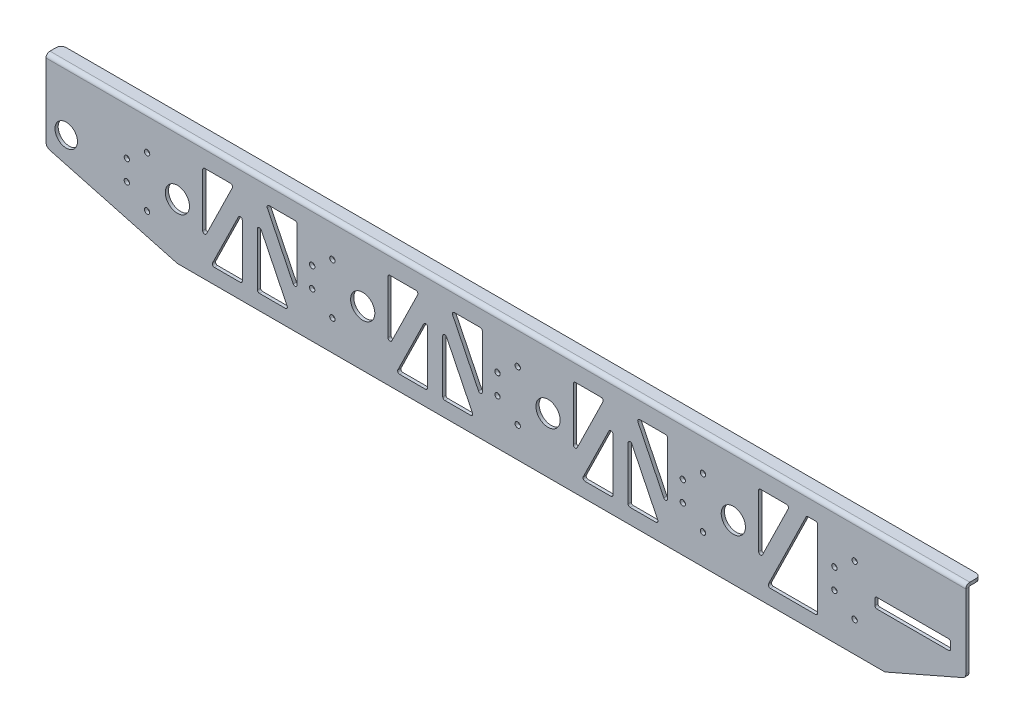
from build123d import *

# Parameters (mm, degrees)
SKETCH1_R                    = 11.9875
SKETCH1_R_2                  = 11.1125
SKETCH1_W                    = 75
SKETCH1_H                    = 10.02
BASE_FLANGE1_DEPTH           = 3.175
EDGE_FLANGE1_STRIP_W         = 14.1732
EDGE_FLANGE1_STRIP_H         = 3.175
EDGE_FLANGE1_STRIP_CUT_DEPTH = 910
EDGE_FLANGE1_DEPTH           = 910
M5_CLEARANCE_HOLE1_D         = 5.3
CUT_EXTRUDE2_REACH           = 784.448
FILLET1_R                    = 2
FILLET2_R                    = 5


# Sheet-metal steps are written as plain solids
with BuildPart() as part:
    # Sketch1 → Base-Flange1 (new body)
    with BuildSketch(Plane.XY):
        Polygon((-130, 60), (780, 60), (780, -20), (700, -55), (0, -55), (-130, -20), align=None)
        Circle(SKETCH1_R, mode=Mode.SUBTRACT)
        with Locations((183.333333333, 0)):
            Circle(SKETCH1_R, mode=Mode.SUBTRACT)
        with Locations((366.666666667, 0)):
            Circle(SKETCH1_R, mode=Mode.SUBTRACT)
        with Locations((550, 0)):
            Circle(SKETCH1_R, mode=Mode.SUBTRACT)
        with Locations((-110, 0)):
            Circle(SKETCH1_R_2, mode=Mode.SUBTRACT)
        with Locations((727.5, 0)):
            Rectangle(SKETCH1_W, SKETCH1_H, mode=Mode.SUBTRACT)
    extrude(amount=-BASE_FLANGE1_DEPTH)

    # Edge-Flange1 strip (across the edge) → Edge-Flange1 strip cut (cut)
    with BuildSketch(Plane(origin=(-130, 60, -3.175), x_dir=(0, -1, 0), z_dir=(1, 0, 0))):
        with Locations((-3.175, -1.5875)):
            Rectangle(EDGE_FLANGE1_STRIP_W, EDGE_FLANGE1_STRIP_H)
    extrude(amount=EDGE_FLANGE1_STRIP_CUT_DEPTH, mode=Mode.SUBTRACT)

    # Edge-Flange1 section (across the edge) → Edge-Flange1 (add)
    with BuildSketch(Plane(origin=(-130, 60, -3.175), x_dir=(0, -1, 0), z_dir=(1, 0, 0))):
        with BuildLine():
            Line((0, 0.7366), (0, 11.825))
            Line((0, 11.825), (3.175, 11.825))
            Line((3.175, 11.825), (3.175, 0.7366))
            ThreePointArc((3.175, 0.7366), (3.390745145, 0.215745145), (3.9116, 0))
            Line((3.9116, 0), (3.9116, -3.175))
            ThreePointArc((3.9116, -3.175), (1.145681115, -2.029318885), (0, 0.7366))
        make_face()
    extrude(amount=EDGE_FLANGE1_DEPTH)

    # M5 Clearance Hole1 (through all)
    with Locations(Plane(origin=(-50, 10, 0), x_dir=(1, 0, 0), z_dir=(0, 0, 1))):
        with Locations((0, 0), (0, -20), (20, -35), (20, 15), (183.333333333, 0), (183.333333333, -20), (203.333333333, -35), (203.333333333, 15), (366.666666667, 0), (366.666666667, -20), (386.666666667, -35), (386.666666667, 15), (550, 0), (550, -20), (570, -35), (570, 15), (700, 0), (700, -20), (720, 15), (720, -35)):
            Hole(M5_CLEARANCE_HOLE1_D / 2)

    # Sketch8 → Cut-Extrude2 (cut, up to next)
    with BuildSketch(Plane.XY, mode=Mode.PRIVATE) as cut_extrude2_sk1:
        Polygon((55.816057945, 40), (25, 40), (25, -22.943437506), align=None)
    cut_extrude2_tool1 = extrude(cut_extrude2_sk1.sketch, amount=-CUT_EXTRUDE2_REACH, mode=Mode.PRIVATE) & part.part
    # Sketch8 → Cut-Extrude2 (cut, up to next)
    with BuildSketch(Plane.XY, mode=Mode.PRIVATE) as cut_extrude2_sk2:
        Polygon((64.166666667, -40), (33.350608721, -40), (64.166666667, 22.943437506), align=None)
    cut_extrude2_tool2 = extrude(cut_extrude2_sk2.sketch, amount=-CUT_EXTRUDE2_REACH, mode=Mode.PRIVATE) & part.part
    # Sketch8 → Cut-Extrude2 (cut, up to next)
    with BuildSketch(Plane.XY, mode=Mode.PRIVATE) as cut_extrude2_sk3:
        Polygon((79.166666667, -40), (79.166666667, 22.943437506), (109.982724612, -40), align=None)
    cut_extrude2_tool3 = extrude(cut_extrude2_sk3.sketch, amount=-CUT_EXTRUDE2_REACH, mode=Mode.PRIVATE) & part.part
    # Sketch8 → Cut-Extrude2 (cut, up to next)
    with BuildSketch(Plane.XY, mode=Mode.PRIVATE) as cut_extrude2_sk4:
        Polygon((118.333333333, 40), (118.333333333, -22.943437506), (87.517275388, 40), align=None)
    cut_extrude2_tool4 = extrude(cut_extrude2_sk4.sketch, amount=-CUT_EXTRUDE2_REACH, mode=Mode.PRIVATE) & part.part
    # Sketch8 → Cut-Extrude2 (cut, up to next)
    with BuildSketch(Plane.XY, mode=Mode.PRIVATE) as cut_extrude2_sk5:
        Polygon((239.149391279, 40), (208.333333333, -22.943437506), (208.333333333, 40), align=None)
    cut_extrude2_tool5 = extrude(cut_extrude2_sk5.sketch, amount=-CUT_EXTRUDE2_REACH, mode=Mode.PRIVATE) & part.part
    # Sketch8 → Cut-Extrude2 (cut, up to next)
    with BuildSketch(Plane.XY, mode=Mode.PRIVATE) as cut_extrude2_sk6:
        Polygon((247.5, 22.943437506), (247.5, -40), (216.683942055, -40), align=None)
    cut_extrude2_tool6 = extrude(cut_extrude2_sk6.sketch, amount=-CUT_EXTRUDE2_REACH, mode=Mode.PRIVATE) & part.part
    # Sketch8 → Cut-Extrude2 (cut, up to next)
    with BuildSketch(Plane.XY, mode=Mode.PRIVATE) as cut_extrude2_sk7:
        Polygon((293.316057945, -40), (262.5, -40), (262.5, 22.943437506), align=None)
    cut_extrude2_tool7 = extrude(cut_extrude2_sk7.sketch, amount=-CUT_EXTRUDE2_REACH, mode=Mode.PRIVATE) & part.part
    # Sketch8 → Cut-Extrude2 (cut, up to next)
    with BuildSketch(Plane.XY, mode=Mode.PRIVATE) as cut_extrude2_sk8:
        Polygon((270.850608721, 40), (301.666666667, 40), (301.666666667, -22.943437506), align=None)
    cut_extrude2_tool8 = extrude(cut_extrude2_sk8.sketch, amount=-CUT_EXTRUDE2_REACH, mode=Mode.PRIVATE) & part.part
    # Sketch8 → Cut-Extrude2 (cut, up to next)
    with BuildSketch(Plane.XY, mode=Mode.PRIVATE) as cut_extrude2_sk9:
        Polygon((422.482724612, 40), (391.666666667, -22.943437506), (391.666666667, 40), align=None)
    cut_extrude2_tool9 = extrude(cut_extrude2_sk9.sketch, amount=-CUT_EXTRUDE2_REACH, mode=Mode.PRIVATE) & part.part
    # Sketch8 → Cut-Extrude2 (cut, up to next)
    with BuildSketch(Plane.XY, mode=Mode.PRIVATE) as cut_extrude2_sk10:
        Polygon((430.833333333, 22.943437506), (430.833333333, -40), (400.017275388, -40), align=None)
    cut_extrude2_tool10 = extrude(cut_extrude2_sk10.sketch, amount=-CUT_EXTRUDE2_REACH, mode=Mode.PRIVATE) & part.part
    # Sketch8 → Cut-Extrude2 (cut, up to next)
    with BuildSketch(Plane.XY, mode=Mode.PRIVATE) as cut_extrude2_sk11:
        Polygon((476.649391279, -40), (445.833333333, -40), (445.833333333, 22.943437506), align=None)
    cut_extrude2_tool11 = extrude(cut_extrude2_sk11.sketch, amount=-CUT_EXTRUDE2_REACH, mode=Mode.PRIVATE) & part.part
    # Sketch8 → Cut-Extrude2 (cut, up to next)
    with BuildSketch(Plane.XY, mode=Mode.PRIVATE) as cut_extrude2_sk12:
        Polygon((454.183942055, 40), (485, 40), (485, -22.943437506), align=None)
    cut_extrude2_tool12 = extrude(cut_extrude2_sk12.sketch, amount=-CUT_EXTRUDE2_REACH, mode=Mode.PRIVATE) & part.part
    # Sketch8 → Cut-Extrude2 (cut, up to next)
    with BuildSketch(Plane.XY, mode=Mode.PRIVATE) as cut_extrude2_sk13:
        Polygon((605.816057945, 40), (575, -22.943437506), (575, 40), align=None)
    cut_extrude2_tool13 = extrude(cut_extrude2_sk13.sketch, amount=-CUT_EXTRUDE2_REACH, mode=Mode.PRIVATE) & part.part
    # Sketch8 → Cut-Extrude2 (cut, up to next)
    with BuildSketch(Plane.XY, mode=Mode.PRIVATE) as cut_extrude2_sk14:
        Polygon((614.166666667, 22.943437506), (614.166666667, -40), (583.350608721, -40), align=None)
    cut_extrude2_tool14 = extrude(cut_extrude2_sk14.sketch, amount=-CUT_EXTRUDE2_REACH, mode=Mode.PRIVATE) & part.part
    # Sketch8 → Cut-Extrude2 (cut, up to next)
    with BuildSketch(Plane.XY, mode=Mode.PRIVATE) as cut_extrude2_sk15:
        Polygon((633.350608721, 40), (622.517275388, 40), (614.166666667, 22.943437506), (614.166666667, -40), (633.350608721, -40), align=None)
    cut_extrude2_tool15 = extrude(cut_extrude2_sk15.sketch, amount=-CUT_EXTRUDE2_REACH, mode=Mode.PRIVATE) & part.part
    add(cut_extrude2_tool1.solids().sort_by_distance((35.272019, 19.018854, 0))[0], mode=Mode.SUBTRACT)
    add(cut_extrude2_tool2.solids().sort_by_distance((53.894647, -19.018854, 0))[0], mode=Mode.SUBTRACT)
    add(cut_extrude2_tool3.solids().sort_by_distance((89.438686, -19.018854, 0))[0], mode=Mode.SUBTRACT)
    add(cut_extrude2_tool4.solids().sort_by_distance((108.061314, 19.018854, 0))[0], mode=Mode.SUBTRACT)
    add(cut_extrude2_tool5.solids().sort_by_distance((218.605353, 19.018854, 0))[0], mode=Mode.SUBTRACT)
    add(cut_extrude2_tool6.solids().sort_by_distance((237.227981, -19.018854, 0))[0], mode=Mode.SUBTRACT)
    add(cut_extrude2_tool7.solids().sort_by_distance((272.772019, -19.018854, 0))[0], mode=Mode.SUBTRACT)
    add(cut_extrude2_tool8.solids().sort_by_distance((291.394647, 19.018854, 0))[0], mode=Mode.SUBTRACT)
    add(cut_extrude2_tool9.solids().sort_by_distance((401.938686, 19.018854, 0))[0], mode=Mode.SUBTRACT)
    add(cut_extrude2_tool10.solids().sort_by_distance((420.561314, -19.018854, 0))[0], mode=Mode.SUBTRACT)
    add(cut_extrude2_tool11.solids().sort_by_distance((456.105353, -19.018854, 0))[0], mode=Mode.SUBTRACT)
    add(cut_extrude2_tool12.solids().sort_by_distance((474.727981, 19.018854, 0))[0], mode=Mode.SUBTRACT)
    add(cut_extrude2_tool13.solids().sort_by_distance((585.272019, 19.018854, 0))[0], mode=Mode.SUBTRACT)
    add(cut_extrude2_tool14.solids().sort_by_distance((603.894647, -19.018854, 0))[0], mode=Mode.SUBTRACT)
    add(cut_extrude2_tool15.solids().sort_by_distance((624.089948, -1.669801, 0))[0], mode=Mode.SUBTRACT)

    # Fillet1
    fillet1_edges = [part.edges().sort_by_distance(p)[0] for p in [
        (247.5, 22.943437506, -1.5875),
        (247.5, -40, -1.5875),
        (216.683942055, -40, -1.5875),
        (293.316057945, -40, -1.5875),
        (262.5, -40, -1.5875),
        (262.5, 22.943437506, -1.5875),
        (270.850608721, 40, -1.5875),
        (301.666666667, 40, -1.5875),
        (301.666666667, -22.943437506, -1.5875),
        (422.482724612, 40, -1.5875),
        (391.666666667, -22.943437506, -1.5875),
        (391.666666667, 40, -1.5875),
        (64.166666667, -40, -1.5875),
        (33.350608721, -40, -1.5875),
        (690, -5.01, -1.5875),
        (64.166666667, 22.943437506, -1.5875),
        (690, 5.01, -1.5875),
        (79.166666667, -40, -1.5875),
        (79.166666667, 22.943437506, -1.5875),
        (109.982724612, -40, -1.5875),
        (765, 5.01, -1.5875),
        (118.333333333, 40, -1.5875),
        (118.333333333, -22.943437506, -1.5875),
        (87.517275388, 40, -1.5875),
        (765, -5.01, -1.5875),
        (239.149391279, 40, -1.5875),
        (208.333333333, -22.943437506, -1.5875),
        (208.333333333, 40, -1.5875),
        (633.350608721, -40, -1.5875),
        (583.350608721, -40, -1.5875),
        (622.517275388, 40, -1.5875),
        (633.350608721, 40, -1.5875),
        (430.833333333, 22.943437506, -1.5875),
        (430.833333333, -40, -1.5875),
        (400.017275388, -40, -1.5875),
        (476.649391279, -40, -1.5875),
        (445.833333333, -40, -1.5875),
        (445.833333333, 22.943437506, -1.5875),
        (454.183942055, 40, -1.5875),
        (485, 40, -1.5875),
        (485, -22.943437506, -1.5875),
        (605.816057945, 40, -1.5875),
        (575, -22.943437506, -1.5875),
        (575, 40, -1.5875),
        (25, 40, -1.5875),
        (55.816057945, 40, -1.5875),
        (25, -22.943437506, -1.5875),
    ]]
    fillet(fillet1_edges, radius=FILLET1_R)

    # Fillet2
    fillet2_edges = [part.edges().sort_by_distance(p)[0] for p in [
        (780, -20, -1.5875),
        (700, -55, -1.5875),
        (0, -55, -1.5875),
        (-130, -20, -1.5875),
        (-130, 58.4125, -15),
        (780, 58.4125, -15),
    ]]
    fillet(fillet2_edges, radius=FILLET2_R)


solid = part.part
